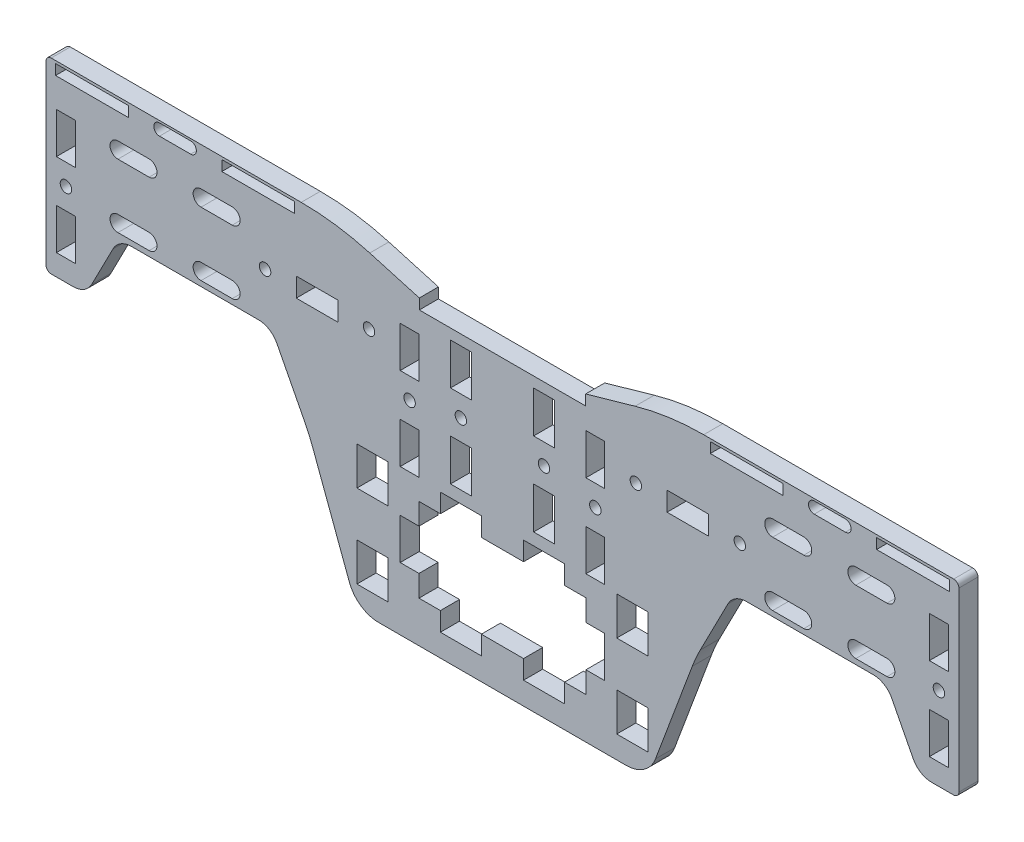
from build123d import *

# Parameters (mm, degrees)
SKETCH1_R           = 1.7526
SKETCH1_W           = 9.525
SKETCH1_H           = 11.684
SKETCH1_W_2         = 6.35
SKETCH1_H_2         = 12.7
SKETCH1_W_3         = 5.741999946
SKETCH1_H_3         = 12.5
SKETCH1_W_4         = 5.842
SKETCH1_W_5         = 12.7
SKETCH1_H_4         = 5.842
BOSS_EXTRUDE1_DEPTH = 5.842
FILLET1_R           = 6.35
FILLET2_R           = 9.525
FILLET4_R           = 76.2
FILLET5_R           = 50.8
FILLET6_R           = 6.35
FILLET7_R           = 1.5875


with BuildPart() as part:
    # Sketch1 → Boss-Extrude1 (new body)
    with BuildSketch(Plane.XY):
        Polygon((25.4, 63.5), (-25.4, 63.5), (-25.4, 66.675), (-50.8, 73.9342438), (-139.446, 73.9342438), (-139.446, 16.7842438), (-127.254, 16.7842438), (-117.187573781, 36.3358938), (-70.673088246, 36.3358938), (-59.046135547, 13.75329052), (-44.45, -25.4), (44.45, -25.4), (59.046135547, 13.75329052), (70.673088246, 36.3358938), (117.187573781, 36.3358938), (127.254, 16.7842438), (139.446, 16.7842438), (139.446, 73.9342438), (50.8, 73.9342438), (25.4, 66.675), align=None)
        with Locations((28.370999973, 38.1)):
            Circle(SKETCH1_R, mode=Mode.SUBTRACT)
        with Locations((-28.370999973, 38.1)):
            Circle(SKETCH1_R, mode=Mode.SUBTRACT)
        with Locations((-12.7, 41.275)):
            Circle(SKETCH1_R, mode=Mode.SUBTRACT)
        with Locations((12.7, 41.275)):
            Circle(SKETCH1_R, mode=Mode.SUBTRACT)
        with Locations((-72.516999946, 50.7499874)):
            Circle(SKETCH1_R, mode=Mode.SUBTRACT)
        with Locations((-40.766999946, 50.7499874)):
            Circle(SKETCH1_R, mode=Mode.SUBTRACT)
        with Locations((40.766999946, 50.7499874)):
            Circle(SKETCH1_R, mode=Mode.SUBTRACT)
        with Locations((72.516999946, 50.7499874)):
            Circle(SKETCH1_R, mode=Mode.SUBTRACT)
        with Locations((133.35, 42.1842438)):
            Circle(SKETCH1_R, mode=Mode.SUBTRACT)
        with Locations((-133.35, 42.1842438)):
            Circle(SKETCH1_R, mode=Mode.SUBTRACT)
        Polygon((25.5, -12.8), (18.95, -12.8), (18.95, -18.542), (6.45, -18.542), (6.45, -12.8), (-6.45, -12.8), (-6.45, -18.542), (-18.95, -18.542), (-18.95, -12.8), (-25.5, -12.8), (-25.5, -6.25), (-31.241999946, -6.25), (-31.241999946, 6.25), (-25.5, 6.25), (-25.5, 12.8), (-18.95, 12.8), (-18.95, 18.542), (-6.45, 18.542), (-6.45, 12.8), (6.45, 12.8), (6.45, 18.542), (18.95, 18.542), (18.95, 12.8), (25.5, 12.8), (25.5, 6.25), (31.241999946, 6.25), (31.241999946, -6.25), (25.5, -6.25), align=None, mode=Mode.SUBTRACT)
        with Locations((39.6875, 12.7)):
            Rectangle(SKETCH1_W, SKETCH1_H, mode=Mode.SUBTRACT)
        with Locations((39.6875, -12.7)):
            Rectangle(SKETCH1_W, SKETCH1_H, mode=Mode.SUBTRACT)
        with Locations((-39.6875, -12.7)):
            Rectangle(SKETCH1_W, SKETCH1_H, mode=Mode.SUBTRACT)
        with Locations((-39.6875, 12.7)):
            Rectangle(SKETCH1_W, SKETCH1_H, mode=Mode.SUBTRACT)
        with Locations((-12.7, 28.575)):
            Rectangle(SKETCH1_W_2, SKETCH1_H_2, mode=Mode.SUBTRACT)
        with Locations((-12.7, 53.975)):
            Rectangle(SKETCH1_W_2, SKETCH1_H_2, mode=Mode.SUBTRACT)
        with BuildLine():
            Line((82.55, 62.1930938), (92.075, 62.1930938))
            ThreePointArc((92.075, 62.1930938), (94.488, 59.7800938), (92.075, 57.3670938))
            Line((92.075, 57.3670938), (82.55, 57.3670938))
            ThreePointArc((82.55, 57.3670938), (80.137, 59.7800938), (82.55, 62.1930938))
        make_face(mode=Mode.SUBTRACT)
        with BuildLine():
            Line((82.55, 42.7620938), (92.075, 42.7620938))
            ThreePointArc((92.075, 42.7620938), (94.488, 40.3490938), (92.075, 37.9360938))
            Line((92.075, 37.9360938), (82.55, 37.9360938))
            ThreePointArc((82.55, 37.9360938), (80.137, 40.3490938), (82.55, 42.7620938))
        make_face(mode=Mode.SUBTRACT)
        with BuildLine():
            Line((107.95, 62.1930938), (117.475, 62.1930938))
            ThreePointArc((117.475, 62.1930938), (119.888, 59.7800938), (117.475, 57.3670938))
            Line((117.475, 57.3670938), (107.95, 57.3670938))
            ThreePointArc((107.95, 57.3670938), (105.537, 59.7800938), (107.95, 62.1930938))
        make_face(mode=Mode.SUBTRACT)
        with BuildLine():
            Line((107.95, 42.7620938), (117.475, 42.7620938))
            ThreePointArc((117.475, 42.7620938), (119.888, 40.3490938), (117.475, 37.9360938))
            Line((117.475, 37.9360938), (107.95, 37.9360938))
            ThreePointArc((107.95, 37.9360938), (105.537, 40.3490938), (107.95, 42.7620938))
        make_face(mode=Mode.SUBTRACT)
        Polygon((63.5, 73.1404938), (76.2, 73.1404938), (85.725, 73.1404938), (85.725, 69.9654938), (76.2, 69.9654938), (63.5, 69.9654938), align=None, mode=Mode.SUBTRACT)
        Polygon((114.3, 73.1404938), (127, 73.1404938), (136.525, 73.1404938), (136.525, 69.9654938), (127, 69.9654938), (114.3, 69.9654938), align=None, mode=Mode.SUBTRACT)
        with Locations((-28.370999973, 50.8)):
            Rectangle(SKETCH1_W_3, SKETCH1_H_3, mode=Mode.SUBTRACT)
        with Locations((-28.370999973, 25.4)):
            Rectangle(SKETCH1_W_3, SKETCH1_H_3, mode=Mode.SUBTRACT)
        with Locations((28.370999973, 50.8)):
            Rectangle(SKETCH1_W_3, SKETCH1_H_3, mode=Mode.SUBTRACT)
        with Locations((28.370999973, 25.4)):
            Rectangle(SKETCH1_W_3, SKETCH1_H_3, mode=Mode.SUBTRACT)
        with Locations((133.35, 29.4842438)):
            Rectangle(SKETCH1_W_4, SKETCH1_H_3, mode=Mode.SUBTRACT)
        with Locations((133.35, 54.8842438)):
            Rectangle(SKETCH1_W_4, SKETCH1_H_3, mode=Mode.SUBTRACT)
        Polygon((-127, 69.9654938), (-136.525, 69.9654938), (-136.525, 73.1404938), (-127, 73.1404938), (-114.3, 73.1404938), (-114.3, 69.9654938), align=None, mode=Mode.SUBTRACT)
        Polygon((-85.725, 73.1404938), (-85.725, 69.9654938), (-76.2, 69.9654938), (-63.5, 69.9654938), (-63.5, 73.1404938), (-76.2, 73.1404938), align=None, mode=Mode.SUBTRACT)
        with BuildLine():
            Line((-107.95, 42.7620938), (-117.475, 42.7620938))
            ThreePointArc((-117.475, 42.7620938), (-119.888, 40.3490938), (-117.475, 37.9360938))
            Line((-117.475, 37.9360938), (-107.95, 37.9360938))
            ThreePointArc((-107.95, 37.9360938), (-105.537, 40.3490938), (-107.95, 42.7620938))
        make_face(mode=Mode.SUBTRACT)
        with BuildLine():
            Line((-107.95, 62.1930938), (-117.475, 62.1930938))
            ThreePointArc((-117.475, 62.1930938), (-119.888, 59.7800938), (-117.475, 57.3670938))
            Line((-117.475, 57.3670938), (-107.95, 57.3670938))
            ThreePointArc((-107.95, 57.3670938), (-105.537, 59.7800938), (-107.95, 62.1930938))
        make_face(mode=Mode.SUBTRACT)
        with BuildLine():
            Line((-82.55, 42.7620938), (-92.075, 42.7620938))
            ThreePointArc((-92.075, 42.7620938), (-94.488, 40.3490938), (-92.075, 37.9360938))
            Line((-92.075, 37.9360938), (-82.55, 37.9360938))
            ThreePointArc((-82.55, 37.9360938), (-80.137, 40.3490938), (-82.55, 42.7620938))
        make_face(mode=Mode.SUBTRACT)
        with BuildLine():
            Line((-82.55, 62.1930938), (-92.075, 62.1930938))
            ThreePointArc((-92.075, 62.1930938), (-94.488, 59.7800938), (-92.075, 57.3670938))
            Line((-92.075, 57.3670938), (-82.55, 57.3670938))
            ThreePointArc((-82.55, 57.3670938), (-80.137, 59.7800938), (-82.55, 62.1930938))
        make_face(mode=Mode.SUBTRACT)
        with Locations((12.7, 28.575)):
            Rectangle(SKETCH1_W_2, SKETCH1_H_2, mode=Mode.SUBTRACT)
        with Locations((12.7, 53.975)):
            Rectangle(SKETCH1_W_2, SKETCH1_H_2, mode=Mode.SUBTRACT)
        with BuildLine():
            Line((-95.25, 69.8003938), (-104.775, 69.8003938))
            ThreePointArc((-104.775, 69.8003938), (-106.5276, 71.5529938), (-104.775, 73.3055938))
            Line((-104.775, 73.3055938), (-95.25, 73.3055938))
            ThreePointArc((-95.25, 73.3055938), (-93.4974, 71.5529938), (-95.25, 69.8003938))
        make_face(mode=Mode.SUBTRACT)
        with Locations((56.641999946, 50.7499874)):
            Rectangle(SKETCH1_W_5, SKETCH1_H_4, mode=Mode.SUBTRACT)
        with Locations((-56.641999946, 50.7499874)):
            Rectangle(SKETCH1_W_5, SKETCH1_H_4, mode=Mode.SUBTRACT)
        with BuildLine():
            Line((95.25, 69.8003938), (104.775, 69.8003938))
            ThreePointArc((104.775, 69.8003938), (106.5276, 71.5529938), (104.775, 73.3055938))
            Line((104.775, 73.3055938), (95.25, 73.3055938))
            ThreePointArc((95.25, 73.3055938), (93.4974, 71.5529938), (95.25, 69.8003938))
        make_face(mode=Mode.SUBTRACT)
        with Locations((-133.35, 29.4842438)):
            Rectangle(SKETCH1_W_4, SKETCH1_H_3, mode=Mode.SUBTRACT)
        with Locations((-133.35, 54.8842438)):
            Rectangle(SKETCH1_W_4, SKETCH1_H_3, mode=Mode.SUBTRACT)
    extrude(amount=BOSS_EXTRUDE1_DEPTH)

    # Fillet1
    fillet1_edges = [part.edges().sort_by_distance(p)[0] for p in [
        (70.673088246, 36.3358938, 2.921),
        (-70.673088246, 36.3358938, 2.921),
    ]]
    fillet(fillet1_edges, radius=FILLET1_R)

    # Fillet2
    fillet2_edges = [part.edges().sort_by_distance(p)[0] for p in [
        (-44.45, -25.4, 2.921),
        (44.45, -25.4, 2.921),
    ]]
    fillet(fillet2_edges, radius=FILLET2_R)

    # Fillet4
    fillet4_edges = [part.edges().sort_by_distance(p)[0] for p in [
        (50.8, 73.9342438, 2.921),
        (-50.8, 73.9342438, 2.921),
    ]]
    fillet(fillet4_edges, radius=FILLET4_R)

    # Fillet5
    fillet5_edges = [part.edges().sort_by_distance(p)[0] for p in [
        (59.046135547, 13.75329052, 2.921),
        (-59.046135547, 13.75329052, 2.921),
    ]]
    fillet(fillet5_edges, radius=FILLET5_R)

    # Fillet6
    fillet6_edges = [part.edges().sort_by_distance(p)[0] for p in [
        (-127.254, 16.7842438, 2.921),
        (127.254, 16.7842438, 2.921),
        (117.187573781, 36.3358938, 2.921),
        (-117.187573781, 36.3358938, 2.921),
    ]]
    fillet(fillet6_edges, radius=FILLET6_R)

    # Fillet7
    fillet7_edges = [part.edges().sort_by_distance(p)[0] for p in [
        (139.446, 16.7842438, 2.921),
        (139.446, 73.9342438, 2.921),
        (-139.446, 73.9342438, 2.921),
        (-139.446, 16.7842438, 2.921),
    ]]
    fillet(fillet7_edges, radius=FILLET7_R)


solid = part.part
